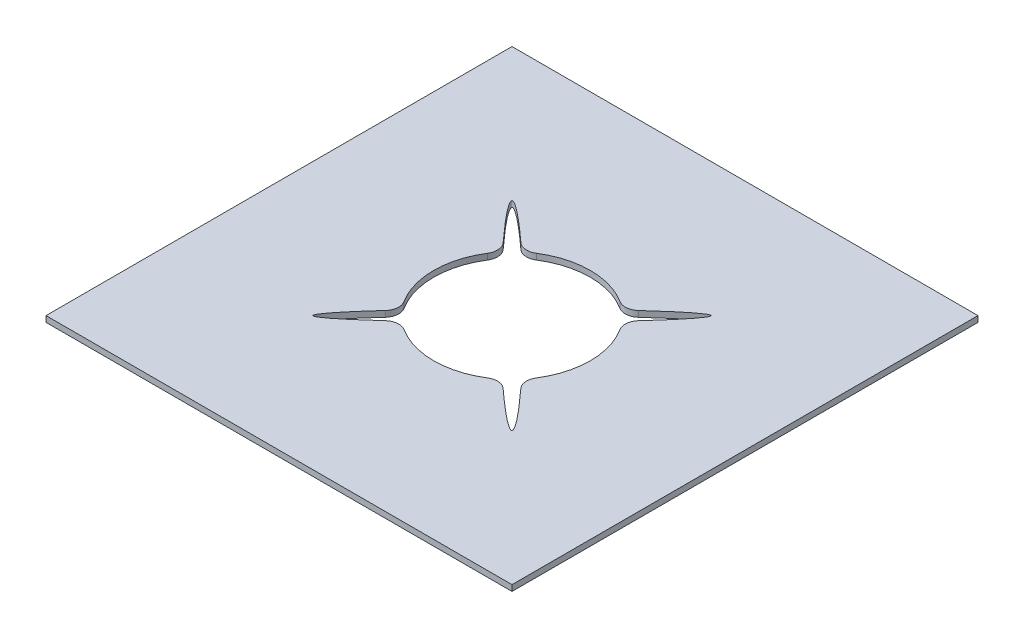
from build123d import *

# Parameters (mm, degrees)
SKETCH1_W           = 500
SKETCH1_H           = 500
BOSS_EXTRUDE1_DEPTH = 6.35
SKETCH2_R           = 84
CUT_EXTRUDE1_DEPTH  = 6.35
CUT_EXTRUDE2_DEPTH  = 6.35
FILLET1_R           = 15


with BuildPart() as part:
    # Sketch1 → Boss-Extrude1 (new body)
    with BuildSketch(Plane(origin=(0, 0, 0), x_dir=(1, 0, 0), z_dir=(0, 1, 0))):
        with Locations((20.161290323, -38.306451613)):
            Rectangle(SKETCH1_W, SKETCH1_H)
    extrude(amount=BOSS_EXTRUDE1_DEPTH)

    # Sketch2 → Cut-Extrude1 (cut)
    with BuildSketch(Plane(origin=(0, 6.35, 0), x_dir=(1, 0, 0), z_dir=(0, 1, 0))):
        with Locations((20.161290323, -38.306451613)):
            Circle(SKETCH2_R)
    extrude(amount=-CUT_EXTRUDE1_DEPTH, mode=Mode.SUBTRACT)

    # Sketch3 → Cut-Extrude2 (cut)
    with BuildSketch(Plane(origin=(0, 6.35, 0), x_dir=(1, 0, 0), z_dir=(0, 1, 0))):
        with BuildLine():
            Line((-38.161167808, 9.435852288), (-27.555823691, 20.043711457))
            add(Edge.make_bspline(
                [(-38.161167808, 9.435852288), (-209.678686167, 191.47297422), (-27.555823691, 20.043711457)],
                knots=[0, 0, 0, 1, 1, 1], degree=2, weights=[1, 0.436781609, 1]))
        make_face()
        with BuildLine():
            Line((-27.581013578, -96.628911245), (-38.188872748, -86.023567127))
            add(Edge.make_bspline(
                [(-27.581013578, -96.628911245), (-209.61813551, -268.146429603), (-38.188872748, -86.023567127)],
                knots=[0, 0, 0, 1, 1, 1], degree=2, weights=[1, 0.436781609, 1]))
        make_face()
        with BuildLine():
            Line((78.483749955, -86.048757015), (67.878405837, -96.656616184))
            add(Edge.make_bspline(
                [(78.483749955, -86.048757015), (250.001268313, -268.085878946), (67.878405837, -96.656616184)],
                knots=[0, 0, 0, 1, 1, 1], degree=2, weights=[1, 0.436781609, 1]))
        make_face()
        with BuildLine():
            Line((67.903595725, 20.016006518), (78.511454894, 9.410662401))
            add(Edge.make_bspline(
                [(67.903595725, 20.016006518), (249.940717656, 191.533524877), (78.511454894, 9.410662401)],
                knots=[0, 0, 0, 1, 1, 1], degree=2, weights=[1, 0.436781609, 1]))
        make_face()
    extrude(amount=-CUT_EXTRUDE2_DEPTH, mode=Mode.SUBTRACT)

    # Fillet1
    fillet1_edges = [part.edges().sort_by_distance(p)[0] for p in [
        (-44.128484725, 3.175, 92.369607499),
        (-33.927432607, 3.175, 102.574717902),
        (74.224445361, 3.175, 102.596227373),
        (84.429555949, 3.175, 92.395175331),
        (-44.106975254, 3.175, -15.782272163),
        (-33.901864775, 3.175, -25.983324098),
        (74.250014887, 3.175, -25.961813301),
        (84.451066746, 3.175, -15.756702637),
    ]]
    fillet(fillet1_edges, radius=FILLET1_R)


solid = part.part
